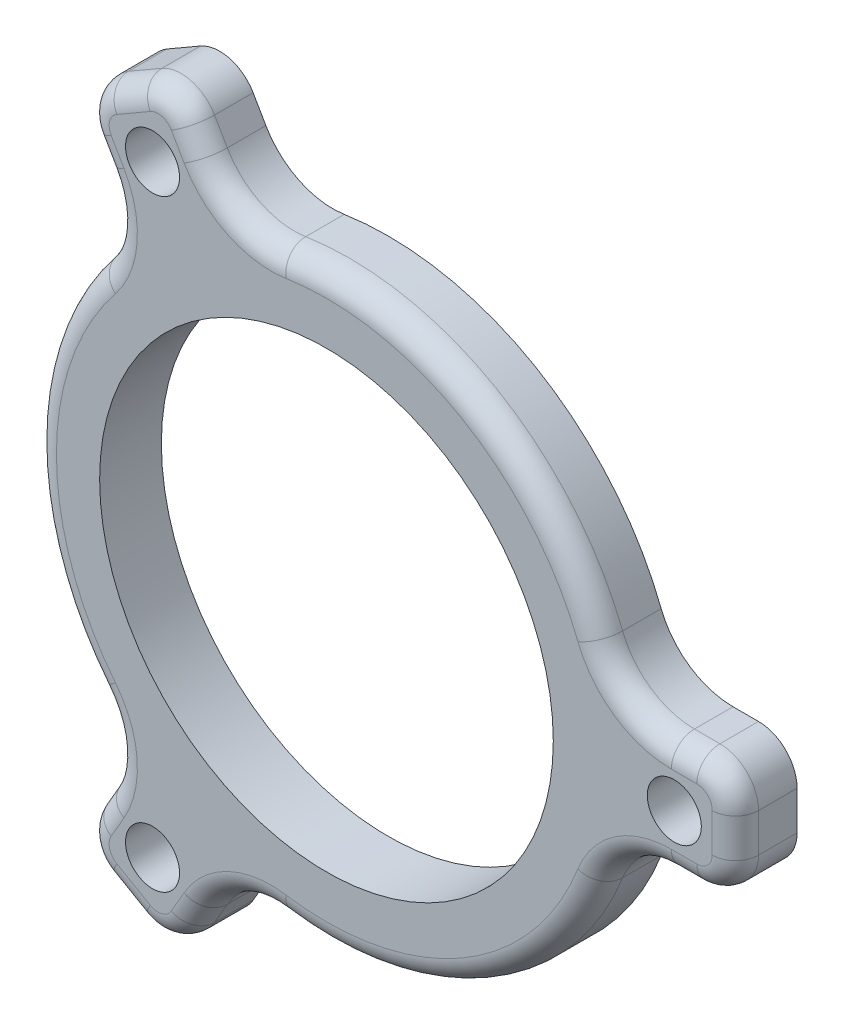
from build123d import *

# Parameters (mm, degrees)
SKETCH1_R           = 29.400000026
SKETCH1_R_2         = 3.5
BOSS_EXTRUDE1_DEPTH = 8
FILLET1_R           = 3


with BuildPart() as part:
    # Sketch1 → Boss-Extrude1 (new body)
    with BuildSketch(Plane.XY):
        with BuildLine():
            Line((-28.843288881, -34.9580418), (-30.495190528, -37.819219382))
            ThreePointArc((-30.495190528, -37.819219382), (-30.994692641, -41.613314607), (-28.665063509, -44.649346401))
            Line((-28.665063509, -44.649346401), (-24.334936491, -47.149346401))
            ThreePointArc((-24.334936491, -47.149346401), (-20.540841265, -47.648848513), (-17.504809472, -45.319219382))
            Line((-17.504809472, -45.319219382), (-15.852907825, -42.4580418))
            ThreePointArc((-15.852907825, -42.4580418), (-11.527824655, -38.446588336), (-5.694184248, -37.570949758))
            ThreePointArc((-5.694184248, -37.570949758), (19, -32.908965344), (35.384489059, -13.854166667))
            ThreePointArc((35.384489059, -13.854166667), (39.059634515, -9.239905166), (44.696196706, -7.5))
            Line((44.696196706, -7.5), (48, -7.5))
            ThreePointArc((48, -7.5), (51.535533906, -6.035533906), (53, -2.5))
            Line((53, -2.5), (53, 2.5))
            ThreePointArc((53, 2.5), (51.535533906, 6.035533906), (48, 7.5))
            Line((48, 7.5), (44.696196706, 7.5))
            ThreePointArc((44.696196706, 7.5), (39.059634515, 9.239905166), (35.384489059, 13.854166667))
            ThreePointArc((35.384489059, 13.854166667), (19, 32.908965344), (-5.694184248, 37.570949758))
            ThreePointArc((-5.694184248, 37.570949758), (-11.527824655, 38.446588336), (-15.852907825, 42.4580418))
            Line((-15.852907825, 42.4580418), (-17.504809472, 45.319219382))
            ThreePointArc((-17.504809472, 45.319219382), (-20.540841265, 47.648848513), (-24.334936491, 47.149346401))
            Line((-24.334936491, 47.149346401), (-28.665063509, 44.649346401))
            ThreePointArc((-28.665063509, 44.649346401), (-30.994692641, 41.613314607), (-30.495190528, 37.819219382))
            Line((-30.495190528, 37.819219382), (-28.843288881, 34.9580418))
            ThreePointArc((-28.843288881, 34.9580418), (-27.53180986, 29.20668317), (-29.690304811, 23.716783092))
            ThreePointArc((-29.690304811, 23.716783092), (-32.237173632, 20.118763287), (-34.35021834, 16.25))
            ThreePointArc((-34.35021834, 16.25), (-37.744312009, -4.400785266), (-29.690304811, -23.716783092))
            ThreePointArc((-29.690304811, -23.716783092), (-27.53180986, -29.20668317), (-28.843288881, -34.9580418))
        make_face()
        Circle(SKETCH1_R, mode=Mode.SUBTRACT)
        with Locations((45.084761958, 0)):
            Circle(SKETCH1_R_2, mode=Mode.SUBTRACT)
        with Locations((-22.542380979, -39.044549179)):
            Circle(SKETCH1_R_2, mode=Mode.SUBTRACT)
        with Locations((-22.542380979, 39.044549179)):
            Circle(SKETCH1_R_2, mode=Mode.SUBTRACT)
    extrude(amount=BOSS_EXTRUDE1_DEPTH)

    # Fillet1
    fillet1_edges = [part.edges().sort_by_distance(p)[0] for p in [
        (-29.669239705, -36.388630591, 8),
        (-16.678858648, -43.888630591, 8),
        (-20.540841265, -47.648848513, 8),
        (-26.5, -45.899346401, 8),
        (46.348098353, 7.5, 8),
        (51.535533906, 6.035533906, 8),
        (53, 0, 8),
        (51.535533906, -6.035533906, 8),
        (-16.678858648, 43.888630591, 8),
        (-20.540841265, 47.648848513, 8),
        (-26.5, 45.899346401, 8),
        (-30.994692641, 41.613314607, 8),
        (-30.994692641, -41.613314607, 8),
        (46.348098353, -7.5, 8),
        (-29.669239705, 36.388630591, 8),
        (-38, 0, 8),
        (-27.53180986, 29.20668317, 8),
        (-11.527824655, 38.446588336, 8),
        (19, 32.908965344, 8),
        (39.059634515, 9.239905166, 8),
        (39.059634515, -9.239905166, 8),
        (19, -32.908965344, 8),
        (-11.527824655, -38.446588336, 8),
        (-27.53180986, -29.20668317, 8),
    ]]
    fillet(fillet1_edges, radius=FILLET1_R)


solid = part.part
